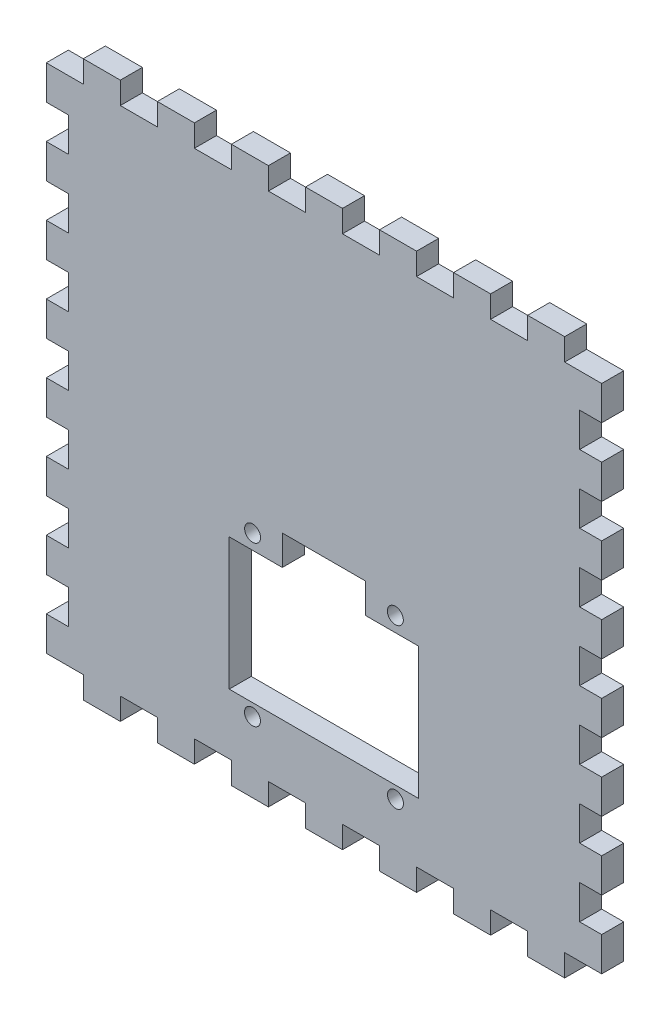
from build123d import *

# Parameters (mm, degrees)
SKETCH1_W           = 80
SKETCH1_H           = 80
BOSS_EXTRUDE1_DEPTH = 3.175
SKETCH2_OUTSIDE_W   = 104.636
SKETCH2_OUTSIDE_H   = 104.636
CUT_EXTRUDE1_DEPTH  = 57.657573413
SKETCH3_R           = 1.15
CUT_EXTRUDE2_DEPTH  = 57.657573413


with BuildPart() as part:
    # Sketch1 → Boss-Extrude1 (new body)
    with BuildSketch(Plane.XY):
        Rectangle(SKETCH1_W, SKETCH1_H)
    extrude(amount=BOSS_EXTRUDE1_DEPTH)

    # Sketch2 outside → Cut-Extrude1 (cut, through all)
    with BuildSketch(Plane.XY.offset(3.175)):
        Rectangle(SKETCH2_OUTSIDE_W, SKETCH2_OUTSIDE_H)
        Polygon((-40, -31.915), (-40, -36.825), (-34.666666667, -36.825), (-34.666666667, -40), (-29.333333333, -40), (-29.333333333, -36.825), (-24, -36.825), (-24, -40), (-18.666666667, -40), (-18.666666667, -36.825), (-13.333333333, -36.825), (-13.333333333, -40), (-8, -40), (-8, -36.825), (-2.666666667, -36.825), (-2.666666667, -40), (2.666666667, -40), (2.666666667, -36.825), (8, -36.825), (8, -40), (13.333333333, -40), (13.333333333, -36.825), (18.666666667, -36.825), (18.666666667, -40), (24, -40), (24, -36.825), (29.333333333, -36.825), (29.333333333, -40), (34.666666667, -40), (34.666666667, -36.825), (40, -36.825), (40, -31.915), (36.825, -31.915), (36.825, -27.005), (40, -27.005), (40, -22.095), (36.825, -22.095), (36.825, -17.185), (40, -17.185), (40, -12.275), (36.825, -12.275), (36.825, -7.365), (40, -7.365), (40, -2.455), (36.825, -2.455), (36.825, 2.455), (40, 2.455), (40, 7.365), (36.825, 7.365), (36.825, 12.275), (40, 12.275), (40, 17.185), (36.825, 17.185), (36.825, 22.095), (40, 22.095), (40, 27.005), (36.825, 27.005), (36.825, 31.915), (40, 31.915), (40, 36.825), (34.666666667, 36.825), (34.666666667, 40), (29.333333333, 40), (29.333333333, 36.825), (24, 36.825), (24, 40), (18.666666667, 40), (18.666666667, 36.825), (13.333333333, 36.825), (13.333333333, 40), (8, 40), (8, 36.825), (2.666666667, 36.825), (2.666666667, 40), (-2.666666667, 40), (-2.666666667, 36.825), (-8, 36.825), (-8, 40), (-13.333333333, 40), (-13.333333333, 36.825), (-18.666666667, 36.825), (-18.666666667, 40), (-24, 40), (-24, 36.825), (-29.333333333, 36.825), (-29.333333333, 40), (-34.666666667, 40), (-34.666666667, 36.825), (-40, 36.825), (-40, 31.915), (-36.825, 31.915), (-36.825, 27.005), (-40, 27.005), (-40, 22.095), (-36.825, 22.095), (-36.825, 17.185), (-40, 17.185), (-40, 12.275), (-36.825, 12.275), (-36.825, 7.365), (-40, 7.365), (-40, 2.455), (-36.825, 2.455), (-36.825, -2.455), (-40, -2.455), (-40, -7.365), (-36.825, -7.365), (-36.825, -12.275), (-40, -12.275), (-40, -17.185), (-36.825, -17.185), (-36.825, -22.095), (-40, -22.095), (-40, -27.005), (-36.825, -27.005), (-36.825, -31.915), align=None, mode=Mode.SUBTRACT)
    extrude(amount=-CUT_EXTRUDE1_DEPTH, mode=Mode.SUBTRACT)

    # Sketch3 → Cut-Extrude2 (cut, through all)
    with BuildSketch(Plane(origin=(0, 0, 0), x_dir=(-1, 0, 0), z_dir=(0, 0, -1))):
        with Locations((-10.28, -6.975)):
            Circle(SKETCH3_R)
        with Locations((-10.3, -29.875)):
            Circle(SKETCH3_R)
        with Locations((10.3, -29.875)):
            Circle(SKETCH3_R)
        with Locations((10.28, -6.975)):
            Circle(SKETCH3_R)
        Polygon((6, -4.825), (6, -9.125), (13.65, -9.125), (13.65, -28.125), (-13.65, -28.125), (-13.65, -9.125), (-6, -9.125), (-6, -4.825), align=None)
    extrude(amount=-CUT_EXTRUDE2_DEPTH, mode=Mode.SUBTRACT)


solid = part.part
